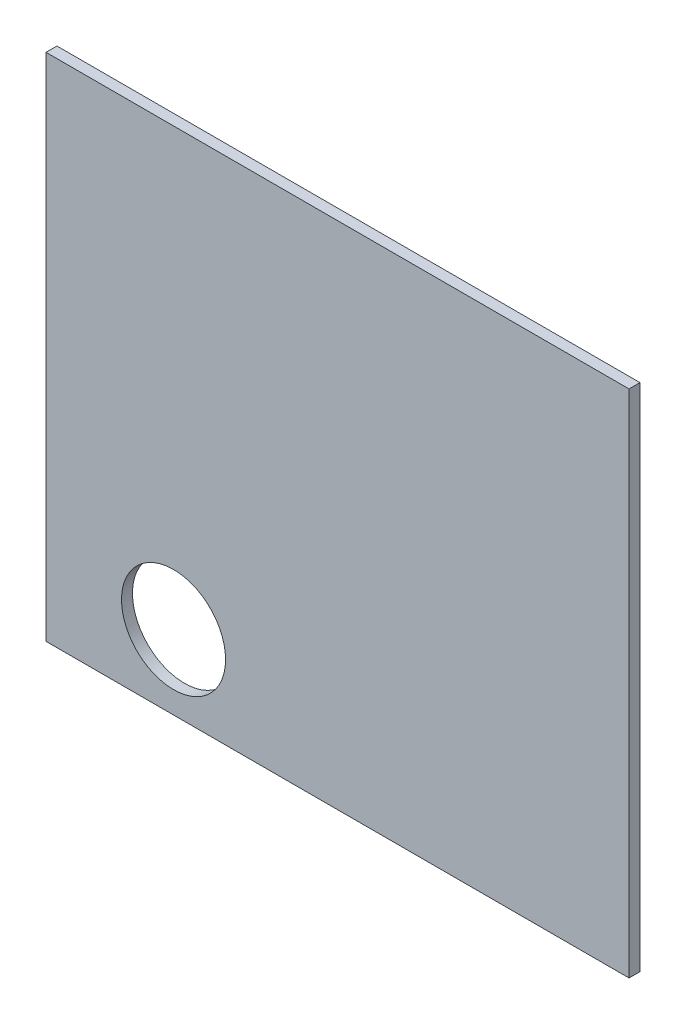
from build123d import *

# Parameters (mm, degrees)
SKETCH1_W           = 160
SKETCH1_H           = 140
BOSS_EXTRUDE1_DEPTH = 3
SKETCH2_R           = 14.275
CUT_EXTRUDE1_DEPTH  = 3


with BuildPart() as part:
    # Sketch1 → Boss-Extrude1 (new body)
    with BuildSketch(Plane.XY):
        with Locations((80, 70)):
            Rectangle(SKETCH1_W, SKETCH1_H)
    extrude(amount=BOSS_EXTRUDE1_DEPTH)

    # Sketch2 → Cut-Extrude1 (cut)
    with BuildSketch(Plane.XY.offset(3)):
        with Locations((35, 20.31)):
            Circle(SKETCH2_R)
    extrude(amount=-CUT_EXTRUDE1_DEPTH, mode=Mode.SUBTRACT)


solid = part.part
